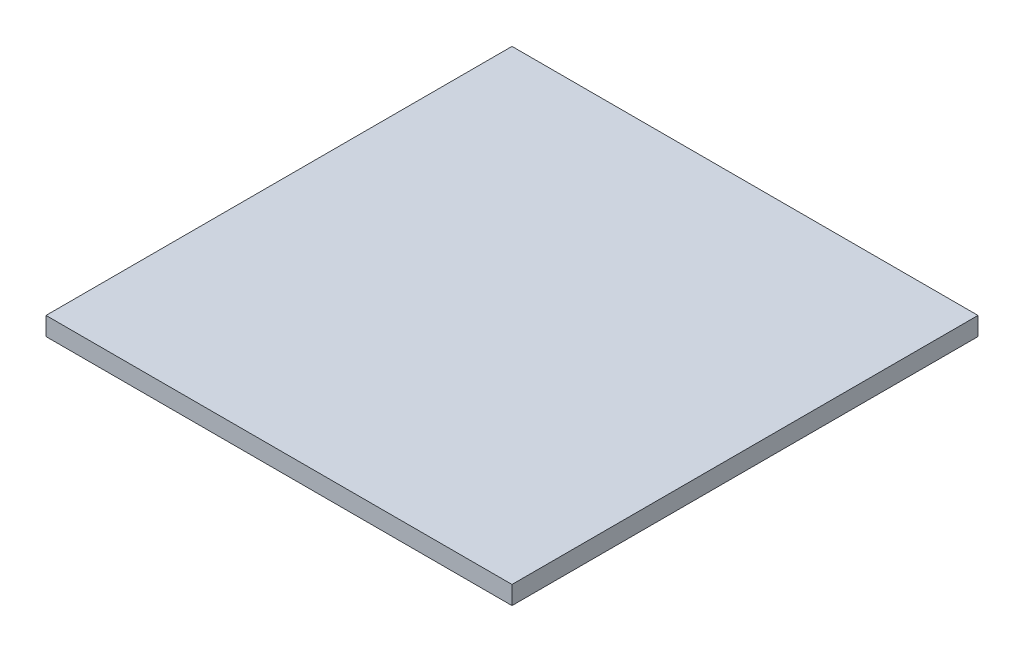
from build123d import *

# Parameters (mm, degrees)
SKETCH1_W                = 254
SKETCH1_H                = 254
BOSS_EXTRUDE1_DEPTH      = 6.35
CONVERT_SOLID1_START     = -127
CONVERT_SOLID1_OUTLINE_W = 3.65
CONVERT_SOLID1_OUTLINE_H = 254
CONVERT_SOLID1_DEPTH     = 254


# Read off the part's stored shape, not the designer's step: Convert-Solid1
with BuildPart() as part:
    # Sketch1 → Boss-Extrude1 (new body)
    with BuildSketch(Plane(origin=(0, 0, 0), x_dir=(1, 0, 0), z_dir=(0, 1, 0))):
        Rectangle(SKETCH1_W, SKETCH1_H)
    extrude(amount=BOSS_EXTRUDE1_DEPTH)

    # Convert-Solid1 outline → Convert-Solid1 (add)
    with BuildSketch(Plane.YZ.offset(CONVERT_SOLID1_START)):
        with Locations((-1.825, 0)):
            Rectangle(CONVERT_SOLID1_OUTLINE_W, CONVERT_SOLID1_OUTLINE_H)
    extrude(amount=CONVERT_SOLID1_DEPTH)


solid = part.part
